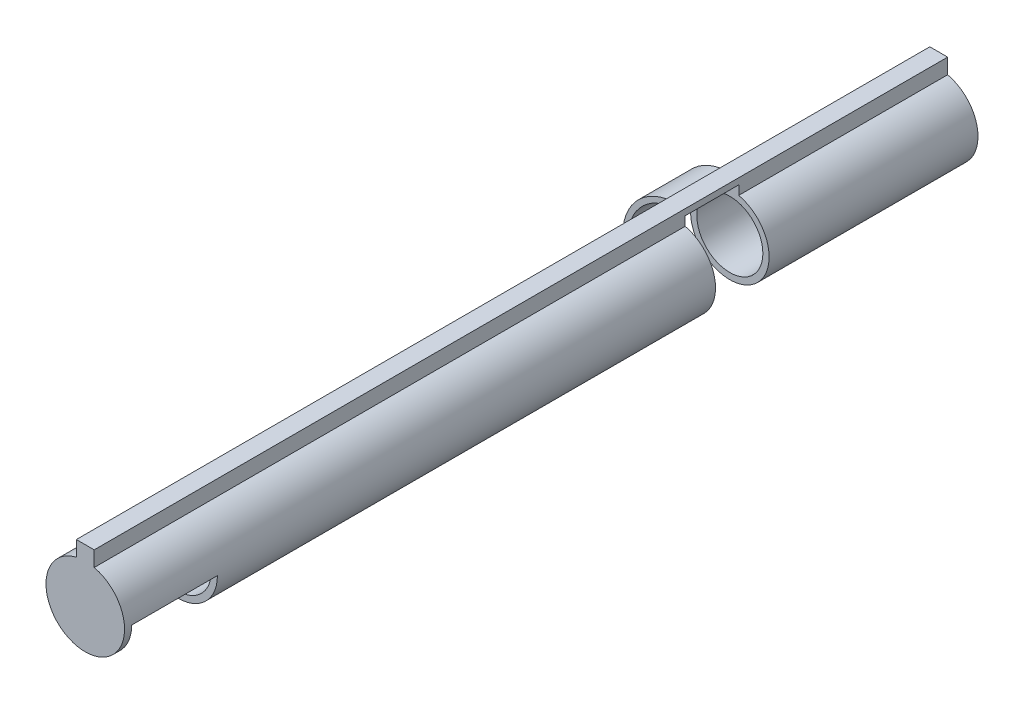
from build123d import *
from build123d.topology import SkipClean

# Parameters (mm, degrees)
SCHIZZO1_R                  = 11
SCHIZZO1_R_2                = 9.25
TUBO_DEPTH                  = 210
INGRESSOCAVI_DEPTH          = 27
SCHIZZO4_R                  = 11
SCHIZZO4_R_2                = 6.5
FONDOCORSA_DEPTH            = 3
SCHIZZO5_R                  = 11
TAPPO_DEPTH                 = 2
BASEINFERIORE_DEPTH         = 239
SCHIZZO7_R                  = 13.5
TAGLIOANELLO_DEPTH          = 15
SUPPORTOANELLO_DEPTH        = 15
FACILITAZIONECAVI_DEPTH     = 3
RACCORDOFACILITAZIONECAVI_R = 8


with BuildPart() as part:
    # Schizzo1 → Tubo (new body)
    with BuildSketch(Plane.XY):
        Circle(SCHIZZO1_R)
        Circle(SCHIZZO1_R_2, mode=Mode.SUBTRACT)
    extrude(amount=TUBO_DEPTH)

    # Schizzo2 → IngressoCavi (add)
    with BuildSketch(Plane.XY.offset(210)):
        with BuildLine():
            Line((0, -9.25), (0, -11))
            ThreePointArc((0, -11), (-7.778174593, 7.778174593), (11, 0))
            Line((11, 0), (9.25, 0))
            ThreePointArc((9.25, 0), (-6.540737726, 6.540737726), (0, -9.25))
        make_face()
    extrude(amount=INGRESSOCAVI_DEPTH)

    # Schizzo4 → FondoCorsa (add)
    with SkipClean():  # the faces are left unmerged after this step: merging them gives an invalid solid
        with BuildSketch(Plane.XY.offset(210)):
            Circle(SCHIZZO4_R)
            Circle(SCHIZZO4_R_2, mode=Mode.SUBTRACT)
        extrude(amount=FONDOCORSA_DEPTH)

    # Schizzo5 → Tappo (add)
    with SkipClean():  # the faces are left unmerged after this step: merging them gives an invalid solid
        with BuildSketch(Plane.XY.offset(237)):
            Circle(SCHIZZO5_R)
        extrude(amount=TAPPO_DEPTH)
    add(part.part.scale(1), mode=Mode.REPLACE)  # the faces are merged on a copy

    # Schizzo6 → BaseInferiore (add)
    with BuildSketch(Plane.XY):
        Polygon((-2.5, 11), (-2.5, 15), (2.5, 15), (2.5, 11), (2.5, 10.712142643), (-2.5, 10.712142643), align=None)
    extrude(amount=BASEINFERIORE_DEPTH)

    # Schizzo7 → TaglioAnello (cut)
    with BuildSketch(Plane.XY.offset(73.5)):
        Circle(SCHIZZO7_R)
    extrude(amount=-TAGLIOANELLO_DEPTH, mode=Mode.SUBTRACT)

    # Schizzo8 → SupportoAnello (add)
    with BuildSketch(Plane.XY.offset(73.5)):
        with BuildLine():
            Line((0, 15), (0, 13.5))
            ThreePointArc((0, 13.5), (-9.545941546, 9.545941546), (-13.5, 0))
            Line((-13.5, 0), (-15, 0))
            ThreePointArc((-15, 0), (-10.606601718, 10.606601718), (0, 15))
        make_face()
    extrude(amount=-SUPPORTOANELLO_DEPTH)

    # Schizzo9 → FacilitazioneCavi (cut)
    with BuildSketch(Plane(origin=(0, 0, 210), x_dir=(-1, 0, 0), z_dir=(0, 0, -1))):
        with BuildLine():
            Line((0, -9.25), (0, 0))
            Line((0, 0), (-9.25, 0))
            ThreePointArc((-9.25, 0), (-6.540737726, -6.540737726), (0, -9.25))
        make_face()
    extrude(amount=-FACILITAZIONECAVI_DEPTH, mode=Mode.SUBTRACT)

    # RaccordoFacilitazioneCavi
    # the kernel refuses this fillet: 8 mm, written as the material it takes off along each edge
    with BuildSketch(Plane(origin=(6.5, 0, 201.530207244), x_dir=(1, 0, 0), z_dir=(0, 0, 1)), Plane(origin=(0, -6.5, 221.469792756), x_dir=(0, -1, 0), z_dir=(0, 0, -1))) as raccordofacilitazionecavi_piece_1:
        with BuildLine():
            CenterArc((6.030405405, 7.296501927), RACCORDOFACILITAZIONECAVI_R, 210.212403153, 35.579578639)
            Line((-0.882921715, 3.270845692), (-1.021188257, 3.190332567))
            ThreePointArc((-1.021188257, 3.190332567), (-0.379082322, 1.65226111), (-0.16, 0))
            Line((-0.16, 0), (0, -0.16))
            ThreePointArc((0, -0.16), (1.375, -0.16), (2.684391892, -0.145930039))
            Line((2.684391892, -0.145930039), (2.75, 0))
        make_face()
    extrude(amount=19.939585512, mode=Mode.SUBTRACT)


solid = part.part
